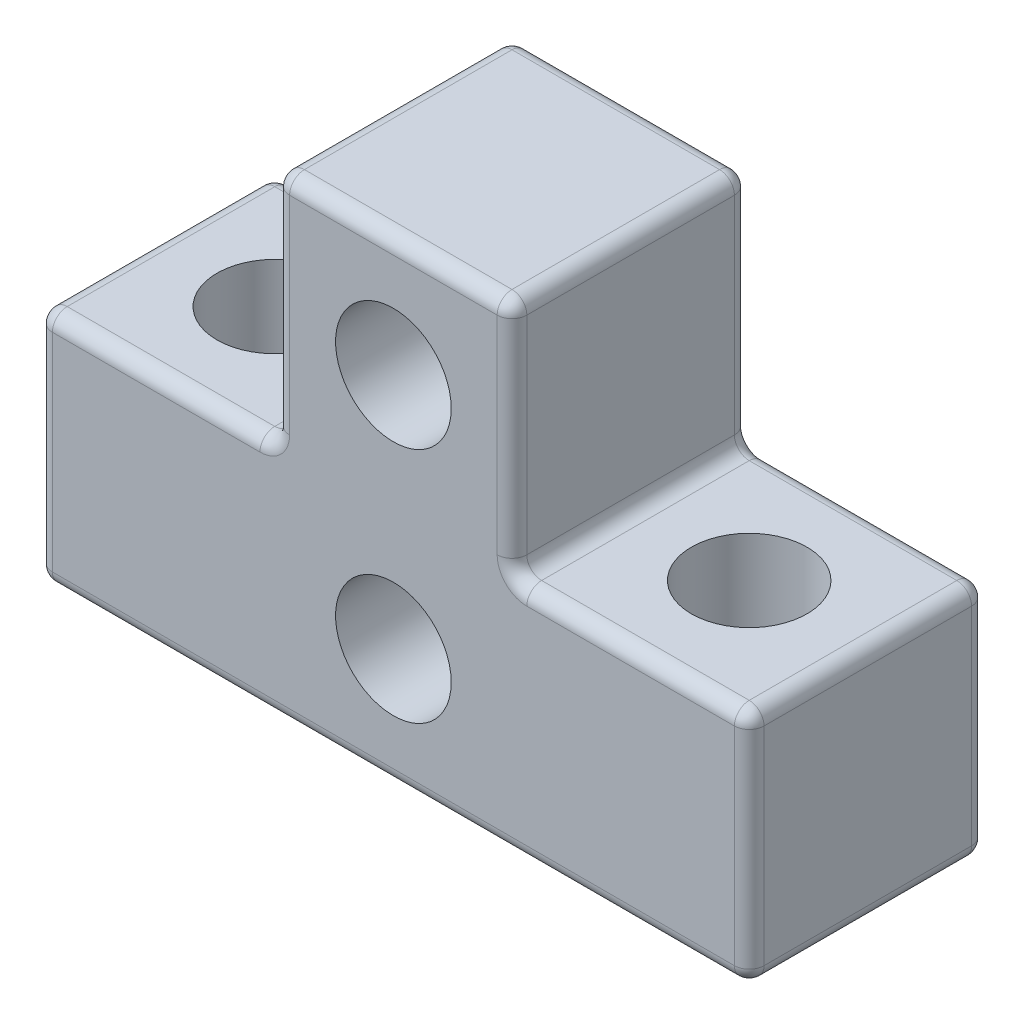
from build123d import *

# Parameters (mm, degrees)
BOSS_EXTRUDE1_DEPTH                      = 8
F_3_9_3_9_DIAMETER_HOLE1_D               = 3.9
F_3_9_3_9_DIAMETER_HOLE1_DEPTH           = 6
F_3_9_3_9_DIAMETER_HOLE1_TIP             = 1.95
F_3_9_3_9_DIAMETER_HOLE1_ON_FACE_2_D     = 3.9
F_3_9_3_9_DIAMETER_HOLE1_ON_FACE_2_DEPTH = 6
F_3_9_3_9_DIAMETER_HOLE1_ON_FACE_2_TIP   = 1.95
F_3_4_3_4_DIAMETER_HOLE1_OUTLINE_R       = 1.7
F_3_4_3_4_DIAMETER_HOLE1_DEPTH           = 1.7500001
F_3_4_3_4_DIAMETER_HOLE1_2_OUTLINE_R     = 1.7
F_3_4_3_4_DIAMETER_HOLE1_2_DEPTH         = 1.7500001
FILLET1_R                                = 0.5


# Read off the part's stored shape, not the designer's step: Ø3.4 (3.4) Diameter Hole1
with BuildPart() as part:
    # Sketch1 → Boss-Extrude1 (new body)
    with BuildSketch(Plane.XY):
        Polygon((-12, 0), (12, 0), (12, 8), (4, 8), (4, 16), (-4, 16), (-4, 8), (-12, 8), align=None)
    extrude(amount=BOSS_EXTRUDE1_DEPTH)

    # Ø3.9 (3.9) Diameter Hole1
    with Locations(Plane(origin=(0, 4, 8), x_dir=(1, 0, 0), z_dir=(0, 0, 1))):
        with Locations((0, 0), (0, 8)):
            Hole(F_3_9_3_9_DIAMETER_HOLE1_D / 2, depth=F_3_9_3_9_DIAMETER_HOLE1_DEPTH)
            with Locations((0, 0, -(F_3_9_3_9_DIAMETER_HOLE1_DEPTH + F_3_9_3_9_DIAMETER_HOLE1_TIP / 2))):  # 90° drill point
                Cone(0, F_3_9_3_9_DIAMETER_HOLE1_D / 2, F_3_9_3_9_DIAMETER_HOLE1_TIP, mode=Mode.SUBTRACT)

    # Ø3.9 (3.9) Diameter Hole1 on face 2
    with Locations(Plane(origin=(8, 8, 4), x_dir=(0, 0, 1), z_dir=(0, 1, 0))):
        with Locations((0, 0), (0, -16)):
            Hole(F_3_9_3_9_DIAMETER_HOLE1_ON_FACE_2_D / 2, depth=F_3_9_3_9_DIAMETER_HOLE1_ON_FACE_2_DEPTH)
            with Locations((0, 0, -(F_3_9_3_9_DIAMETER_HOLE1_ON_FACE_2_DEPTH + F_3_9_3_9_DIAMETER_HOLE1_ON_FACE_2_TIP / 2))):  # 90° drill point
                Cone(0, F_3_9_3_9_DIAMETER_HOLE1_ON_FACE_2_D / 2, F_3_9_3_9_DIAMETER_HOLE1_ON_FACE_2_TIP, mode=Mode.SUBTRACT)

    # Ø3.4 (3.4) Diameter Hole1 outline → Ø3.4 (3.4) Diameter Hole1 (cut)
    with BuildSketch(Plane(origin=(0, 0, 0), x_dir=(1, 0, 0), z_dir=(0, 1, 0))):
        with Locations((-8, -4)):
            Circle(F_3_4_3_4_DIAMETER_HOLE1_OUTLINE_R)
        with Locations((8, -4)):
            Circle(F_3_4_3_4_DIAMETER_HOLE1_OUTLINE_R)
    extrude(amount=F_3_4_3_4_DIAMETER_HOLE1_DEPTH, mode=Mode.SUBTRACT)

    # 3.4 _3.4_ Diameter Hole1 2 outline → 3.4 _3.4_ Diameter Hole1 2 (cut)
    with BuildSketch(Plane.XY):
        with Locations((0, 4)):
            Circle(F_3_4_3_4_DIAMETER_HOLE1_2_OUTLINE_R)
        with Locations((0, 12)):
            Circle(F_3_4_3_4_DIAMETER_HOLE1_2_OUTLINE_R)
    extrude(amount=F_3_4_3_4_DIAMETER_HOLE1_2_DEPTH, mode=Mode.SUBTRACT)

    # Fillet1
    fillet1_edges = [part.edges().sort_by_distance(p)[0] for p in [
        (8, 8, 0),
        (12, 4, 0),
        (0, 0, 0),
        (-12, 4, 0),
        (12, 4, 8),
        (-12, 8, 4),
        (-4, 8, 4),
        (-4, 16, 4),
        (4, 16, 4),
        (4, 8, 4),
        (12, 8, 4),
        (12, 0, 4),
        (-12, 0, 4),
        (8, 8, 8),
        (4, 12, 8),
        (0, 16, 8),
        (-4, 12, 8),
        (-8, 8, 8),
        (-12, 4, 8),
        (-8, 8, 0),
        (0, 0, 8),
        (-4, 12, 0),
        (0, 16, 0),
        (4, 12, 0),
    ]]
    fillet(fillet1_edges, radius=FILLET1_R)


solid = part.part
